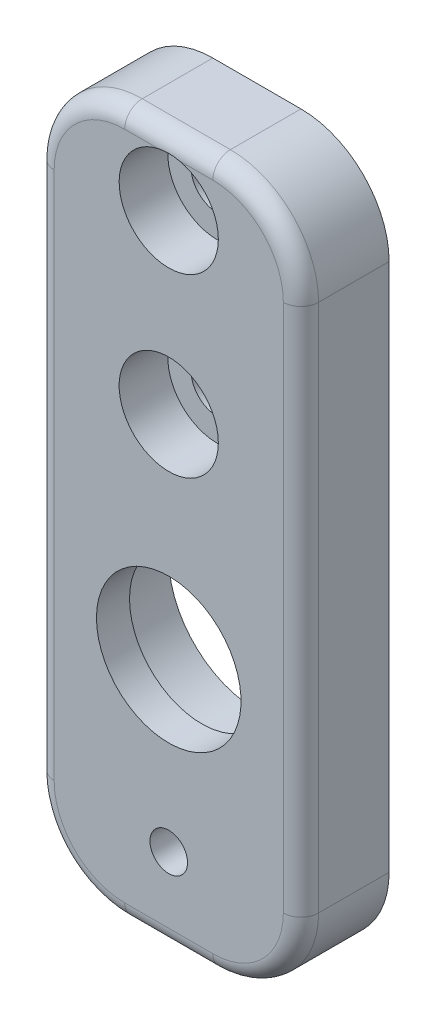
from build123d import *

# Parameters (mm, degrees)
SKETCH1_W                                      = 6.35
SKETCH1_H                                      = 50.8
BODY_DEPTH                                     = 19.05
SKETCH2_R                                      = 5.207
PITCH_AXLE_OPENING_DEPTH                       = 6.35
CBORE_FOR_6_SOCKET_HEAD_CAP_SCREW1_D           = 3.7973
CBORE_FOR_6_SOCKET_HEAD_CAP_SCREW1_CBORE_D     = 7.14502
CBORE_FOR_6_SOCKET_HEAD_CAP_SCREW1_CBORE_DEPTH = 3.5052
F_6_32_TAPPED_HOLE1_D                          = 2.7051
F_6_32_TAPPED_HOLE1_DEPTH                      = 5.08
F_6_32_TAPPED_HOLE1_TIP                        = 0.81269403
SKETCH2_3_R                                    = 6.35
SKETCH2_3_R_2                                  = 5.207
PITCH_BEARING_RECESS_DEPTH                     = 3.96748
FILLET1_R                                      = 6.35
FILLET2_R                                      = 1.27


with BuildPart() as part:
    # Sketch1 → Body (new body)
    with BuildSketch(Plane(origin=(0, 0, 0), x_dir=(0, 0, -1), z_dir=(1, 0, 0))):
        with Locations((3.175, 25.4)):
            Rectangle(SKETCH1_W, SKETCH1_H)
    extrude(amount=BODY_DEPTH)

    # Sketch2 → Pitch Axle Opening (cut)
    with BuildSketch(Plane(origin=(0, 0, -6.35), x_dir=(-1, 0, 0), z_dir=(0, 0, -1))):
        with Locations((-9.525, 18.034)):
            Circle(SKETCH2_R)
    extrude(amount=-PITCH_AXLE_OPENING_DEPTH, mode=Mode.SUBTRACT)

    # CBORE for #6 Socket Head Cap Screw1 (through all)
    with Locations(Plane.XY):
        with Locations((9.525, 46.0375), (9.525, 33.3375)):
            CounterBoreHole(CBORE_FOR_6_SOCKET_HEAD_CAP_SCREW1_D / 2, CBORE_FOR_6_SOCKET_HEAD_CAP_SCREW1_CBORE_D / 2, CBORE_FOR_6_SOCKET_HEAD_CAP_SCREW1_CBORE_DEPTH)

    # #6-32 Tapped Hole1
    with Locations(Plane(origin=(9.525, 6.034, 0), x_dir=(1, 0, 0), z_dir=(0, 0, 1))):
        with Locations((0, 0)):
            Hole(F_6_32_TAPPED_HOLE1_D / 2, depth=F_6_32_TAPPED_HOLE1_DEPTH)
            with Locations((0, 0, -(F_6_32_TAPPED_HOLE1_DEPTH + F_6_32_TAPPED_HOLE1_TIP / 2))):  # 118° drill point
                Cone(0, F_6_32_TAPPED_HOLE1_D / 2, F_6_32_TAPPED_HOLE1_TIP, mode=Mode.SUBTRACT)

    # Sketch2<3> → Pitch Bearing Recess (cut)
    with BuildSketch(Plane(origin=(0, 0, -6.35), x_dir=(-1, 0, 0), z_dir=(0, 0, -1))):
        with Locations((-9.525, 18.034)):
            Circle(SKETCH2_3_R)
        with Locations((-9.525, 18.034)):
            Circle(SKETCH2_3_R_2, mode=Mode.SUBTRACT)
    extrude(amount=-PITCH_BEARING_RECESS_DEPTH, mode=Mode.SUBTRACT)

    # Fillet1
    fillet1_edges = [part.edges().sort_by_distance(p)[0] for p in [
        (19.05, 50.8, -3.175),
        (19.05, 0, -3.175),
        (0, 50.8, -3.175),
        (0, 0, -3.175),
    ]]
    fillet(fillet1_edges, radius=FILLET1_R)

    # Fillet2
    # the kernel refuses this fillet: 1.27 mm, written as the material it takes off along each edge
    with BuildSketch(Plane(origin=(6.35, 50.8, 0), x_dir=(0, -1, 0), z_dir=(1, 0, 0))) as fillet2_piece_1:
        with BuildLine():
            CenterArc((FILLET2_R, FILLET2_R), FILLET2_R, 180, 90)
            Line((0, FILLET2_R), (0, 0))
            Line((0, 0), (FILLET2_R, 0))
        make_face()
    extrude(amount=6.35, mode=Mode.SUBTRACT)
    with BuildSketch(Plane(origin=(0, 6.35, 0), x_dir=(1, 0, 0), z_dir=(0, 1, 0))) as fillet2_piece_2:
        with BuildLine():
            CenterArc((FILLET2_R, FILLET2_R), FILLET2_R, 180, 90)
            Line((0, FILLET2_R), (0, 0))
            Line((0, 0), (FILLET2_R, 0))
        make_face()
    extrude(amount=38.1, mode=Mode.SUBTRACT)
    with BuildSketch(Plane(origin=(6.35, 0, 0), x_dir=(0, 1, 0), z_dir=(1, 0, 0))) as fillet2_piece_3:
        with BuildLine():
            CenterArc((FILLET2_R, -FILLET2_R), FILLET2_R, 90, 90)
            Line((0, -FILLET2_R), (0, 0))
            Line((0, 0), (FILLET2_R, 0))
        make_face()
    extrude(amount=6.35, mode=Mode.SUBTRACT)
    with BuildSketch(Plane(origin=(19.05, 6.35, 0), x_dir=(-1, 0, 0), z_dir=(0, 1, 0))) as fillet2_piece_4:
        with BuildLine():
            CenterArc((FILLET2_R, -FILLET2_R), FILLET2_R, 90, 90)
            Line((0, -FILLET2_R), (0, 0))
            Line((0, 0), (FILLET2_R, 0))
        make_face()
    extrude(amount=38.1, mode=Mode.SUBTRACT)
    with BuildSketch(Plane(origin=(12.7, 6.35, 0), x_dir=(0, -1, 0), z_dir=(-1, 0, 0))) as fillet2_piece_5:
        with BuildLine():
            CenterArc((6.35 - FILLET2_R, -FILLET2_R), FILLET2_R, 0, 90)
            Line((6.35, -FILLET2_R), (6.35, 0))
            Line((6.35, 0), (6.35 - FILLET2_R, 0))
        make_face()
    revolve(axis=Axis((12.7, 6.35, 0), (0, 0, 1)), revolution_arc=90, mode=Mode.SUBTRACT)
    with BuildSketch(Plane(origin=(6.35, 6.35, 0), x_dir=(0, -1, 0), z_dir=(1, 0, 0))) as fillet2_piece_6:
        with BuildLine():
            CenterArc((6.35 - FILLET2_R, FILLET2_R), FILLET2_R, 270, 90)
            Line((6.35, FILLET2_R), (6.35, 0))
            Line((6.35, 0), (6.35 - FILLET2_R, 0))
        make_face()
    revolve(axis=Axis((6.35, 6.35, 0), (0, 0, -1)), revolution_arc=90, mode=Mode.SUBTRACT)
    with BuildSketch(Plane(origin=(12.7, 44.45, 0), x_dir=(1, 0, 0), z_dir=(0, -1, 0))) as fillet2_piece_7:
        with BuildLine():
            CenterArc((6.35 - FILLET2_R, -FILLET2_R), FILLET2_R, 0, 90)
            Line((6.35, -FILLET2_R), (6.35, 0))
            Line((6.35, 0), (6.35 - FILLET2_R, 0))
        make_face()
    revolve(axis=Axis((12.7, 44.45, 0), (0, 0, 1)), revolution_arc=90, mode=Mode.SUBTRACT)
    with BuildSketch(Plane(origin=(6.35, 44.45, 0), x_dir=(-1, 0, 0), z_dir=(0, -1, 0))) as fillet2_piece_8:
        with BuildLine():
            CenterArc((6.35 - FILLET2_R, FILLET2_R), FILLET2_R, 270, 90)
            Line((6.35, FILLET2_R), (6.35, 0))
            Line((6.35, 0), (6.35 - FILLET2_R, 0))
        make_face()
    revolve(axis=Axis((6.35, 44.45, 0), (0, 0, -1)), revolution_arc=90, mode=Mode.SUBTRACT)


solid = part.part
